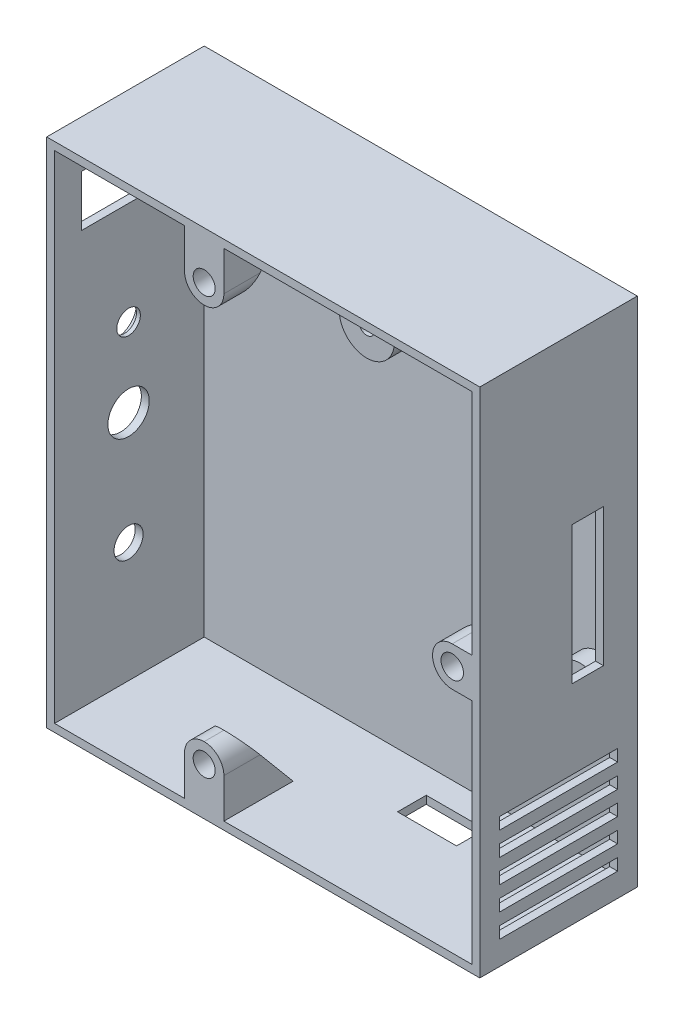
from build123d import *

# Parameters (mm, degrees)
SKETCH1_W                = 110
SKETCH1_H                = 130
BOSS_EXTRUDE1_DEPTH      = 40
SHELL1_T                 = -2
SKETCH2_W                = 15
SKETCH2_H                = 7.298661228
CUT_EXTRUDE1_DEPTH       = 2
SKETCH3_W                = 8
SKETCH3_H                = 35
CUT_EXTRUDE2_DEPTH       = 2
SKETCH5_R                = 3
SKETCH5_R_2              = 5.25
SKETCH5_R_3              = 3.7
SKETCH5_W                = 24
SKETCH5_H                = 13
CUT_EXTRUDE3_DEPTH       = 2
SKETCH6_W                = 30
SKETCH6_H                = 3
CUT_EXTRUDE4_DEPTH       = 2
SKETCH7_R                = 7
SKETCH7_R_2              = 2
BOSS_EXTRUDE2_DEPTH      = 5
BOSS_EXTRUDE3_DEPTH      = 5
FILLET1_R                = 5
BOSS_EXTRUDE4_DEPTH      = 5
BOSS_EXTRUDE4_DEPTH_BACK = 5
FILLET2_R                = 5
CUT_EXTRUDE9_REACH       = 96.074
SKETCH11_R               = 2.8
CUT_EXTRUDE10_REACH      = 96.074
SKETCH13_R               = 2.85
FILLET1_OF_MIRROR1_R     = 5
SKETCH14_R               = 5
CUT_EXTRUDE11_DEPTH      = 1
BOSS_EXTRUDE5_START      = 1
SKETCH15_R               = 6
SKETCH15_R_2             = 5
BOSS_EXTRUDE5_DEPTH      = 1
FILLET3_R                = 1


with BuildPart() as part:
    # Sketch1 → Boss-Extrude1 (new body)
    with BuildSketch(Plane.XY):
        Rectangle(SKETCH1_W, SKETCH1_H)
    extrude(amount=BOSS_EXTRUDE1_DEPTH)

    # Shell1
    shell1_openings = [part.faces().sort_by_distance(p)[0] for p in [
        (0, 0, 40),
    ]]
    offset(amount=SHELL1_T, openings=shell1_openings, kind=Kind.INTERSECTION)

    # Sketch2 → Cut-Extrude1 (cut)
    with BuildSketch(Plane.XZ.offset(65)):
        with Locations((17.5, 12.249330614)):
            Rectangle(SKETCH2_W, SKETCH2_H)
    extrude(amount=-CUT_EXTRUDE1_DEPTH, mode=Mode.SUBTRACT)

    # Sketch3 → Cut-Extrude2 (cut)
    with BuildSketch(Plane(origin=(55, 0, 0), x_dir=(0, 0, -1), z_dir=(1, 0, 0))):
        with Locations((-12.6, 5.5)):
            Rectangle(SKETCH3_W, SKETCH3_H)
    extrude(amount=-CUT_EXTRUDE2_DEPTH, mode=Mode.SUBTRACT)

    # Sketch5 → Cut-Extrude3 (cut)
    with BuildSketch(Plane.ZY.offset(55)):
        with Locations((21.210132709, 15.904045732)):
            Circle(SKETCH5_R)
        with Locations((21.210132709, -4.045954268)):
            Circle(SKETCH5_R_2)
        with Locations((21.210132709, -32.595954268)):
            Circle(SKETCH5_R_3)
        with Locations((21.210132709, 48.5)):
            Rectangle(SKETCH5_W, SKETCH5_H)
    extrude(amount=-CUT_EXTRUDE3_DEPTH, mode=Mode.SUBTRACT)

    # Sketch6 → Cut-Extrude4 (cut)
    with BuildSketch(Plane(origin=(55, 0, 0), x_dir=(0, 0, -1), z_dir=(1, 0, 0))):
        with Locations((-20, -33.5)):
            Rectangle(SKETCH6_W, SKETCH6_H)
        with Locations((-20, -39.5)):
            Rectangle(SKETCH6_W, SKETCH6_H)
        with Locations((-20, -45.5)):
            Rectangle(SKETCH6_W, SKETCH6_H)
        with Locations((-20, -51.5)):
            Rectangle(SKETCH6_W, SKETCH6_H)
        with Locations((-20, -57.5)):
            Rectangle(SKETCH6_W, SKETCH6_H)
    extrude(amount=-CUT_EXTRUDE4_DEPTH, mode=Mode.SUBTRACT)

    # Sketch7 → Boss-Extrude2 (add)
    # profile 1 of 2: a face of its own
    with BuildSketch(Plane.XY.offset(2)):
        with Locations((-6.7, 30.999839281)):
            Circle(SKETCH7_R)
        with Locations((-6.7, 30.999839281)):
            Circle(SKETCH7_R_2, mode=Mode.SUBTRACT)
    # profile 2 of 2: a face of its own
    with BuildSketch(Plane.XY.offset(2)):
        with Locations((47.55, -23.000160719)):
            Circle(SKETCH7_R)
        with Locations((47.55, -23.000160719)):
            Circle(SKETCH7_R_2, mode=Mode.SUBTRACT)
    extrude(amount=BOSS_EXTRUDE2_DEPTH)

    # Sketch9 → Boss-Extrude3 (add, symmetric)
    with BuildSketch(Plane(origin=(-15, 0, 0), x_dir=(0, 0, -1), z_dir=(1, 0, 0))):
        Polygon((-40, 63), (-40, 48), (-35, 48), (-22.413505532, 63), align=None)
    boss_extrude3 = extrude(amount=BOSS_EXTRUDE3_DEPTH, both=True)

    # Fillet1
    fillet1_edges = [part.edges().sort_by_distance(p)[0] for p in [
        (-10, 48, 37.5),
        (-20, 48, 37.5),
    ]]
    fillet(fillet1_edges, radius=FILLET1_R - 0.0001)  # a hair under: the kernel refuses the full size

    # Sketch10 → Boss-Extrude4 (add, two sides: drawn at the far end of the back side and taken through both)
    with BuildSketch(Plane(origin=(0, 0, 0), x_dir=(1, 0, 0), z_dir=(0, 1, 0)).offset(-BOSS_EXTRUDE4_DEPTH_BACK)):
        Polygon((53, -26.609003688), (53, -40), (43, -40), (43, -35), align=None)
    extrude(amount=BOSS_EXTRUDE4_DEPTH + BOSS_EXTRUDE4_DEPTH_BACK)

    # Fillet2
    fillet2_edges = [part.edges().sort_by_distance(p)[0] for p in [
        (43, 5, 37.5),
        (43, -5, 37.5),
    ]]
    fillet(fillet2_edges, radius=FILLET2_R - 0.0001)  # a hair under: the kernel refuses the full size

    # Cut-Extrude9: up to this plane
    cut_extrude9_end = Plane(origin=(-20, 48, 35), z_dir=(0, -0.6427876096865434, -0.7660444431189748))
    # Sketch11 → Cut-Extrude9 (cut, up to the surface)
    with BuildSketch(Plane.XY.offset(40), mode=Mode.PRIVATE) as cut_extrude9_sk1:
        with Locations((-15, 53)):
            Circle(SKETCH11_R)
    cut_extrude9_tool1 = split(extrude(cut_extrude9_sk1.sketch, amount=-CUT_EXTRUDE9_REACH, mode=Mode.PRIVATE), bisect_by=cut_extrude9_end, keep=Keep.BOTH, mode=Mode.PRIVATE)
    cut_extrude9 = cut_extrude9_tool1.solids().sort_by_distance((-15, 53, 40))[0]
    add(cut_extrude9, mode=Mode.SUBTRACT)

    # Cut-Extrude10: up to this plane
    cut_extrude10_end = Plane(origin=(43, -5, 35), z_dir=(-0.6427876096865458, 0, -0.7660444431189727))
    # Sketch13 → Cut-Extrude10 (cut, up to the surface)
    with BuildSketch(Plane.XY.offset(40), mode=Mode.PRIVATE) as cut_extrude10_sk1:
        with Locations((48, 0)):
            Circle(SKETCH13_R)
    cut_extrude10_tool1 = split(extrude(cut_extrude10_sk1.sketch, amount=-CUT_EXTRUDE10_REACH, mode=Mode.PRIVATE), bisect_by=cut_extrude10_end, keep=Keep.BOTH, mode=Mode.PRIVATE)
    add(cut_extrude10_tool1.solids().sort_by_distance((48, 0, 40))[0], mode=Mode.SUBTRACT)

    # Mirror1: Boss-Extrude3, Cut-Extrude9 across plane
    add(boss_extrude3.mirror(Plane.ZX))
    add(cut_extrude9.mirror(Plane.ZX), mode=Mode.SUBTRACT)

    # Fillet1 of Mirror1
    fillet1_of_mirror1_edges = [part.edges().sort_by_distance(p)[0] for p in [
        (-10, -48, 37.5),
        (-20, -48, 37.5),
    ]]
    fillet(fillet1_of_mirror1_edges, radius=FILLET1_OF_MIRROR1_R - 0.0001)  # a hair under: the kernel refuses the full size

    # Sketch14 → Cut-Extrude11 (cut)
    with BuildSketch(Plane.ZY.offset(55)):
        with Locations((21.210132709, 15.904045732)):
            Circle(SKETCH14_R)
    extrude(amount=-CUT_EXTRUDE11_DEPTH, mode=Mode.SUBTRACT)

    # Sketch15 → Boss-Extrude5 (add)
    with BuildSketch(Plane.ZY.offset(55).offset(BOSS_EXTRUDE5_START)):
        with Locations(Location((21.210132709, 15.904045732, 0), (0, 0, 180))):
            Circle(SKETCH15_R)
        with Locations((21.210132709, 15.904045732)):
            Circle(SKETCH15_R_2, mode=Mode.SUBTRACT)
    extrude(amount=-BOSS_EXTRUDE5_DEPTH)

    # Fillet3
    fillet3_edges = [part.edges().sort_by_distance(p)[0] for p in [
        (-55, 15.904045732, 27.210132709),
    ]]
    fillet(fillet3_edges, radius=FILLET3_R - 0.0001)  # a hair under: the kernel refuses the full size


solid = part.part
